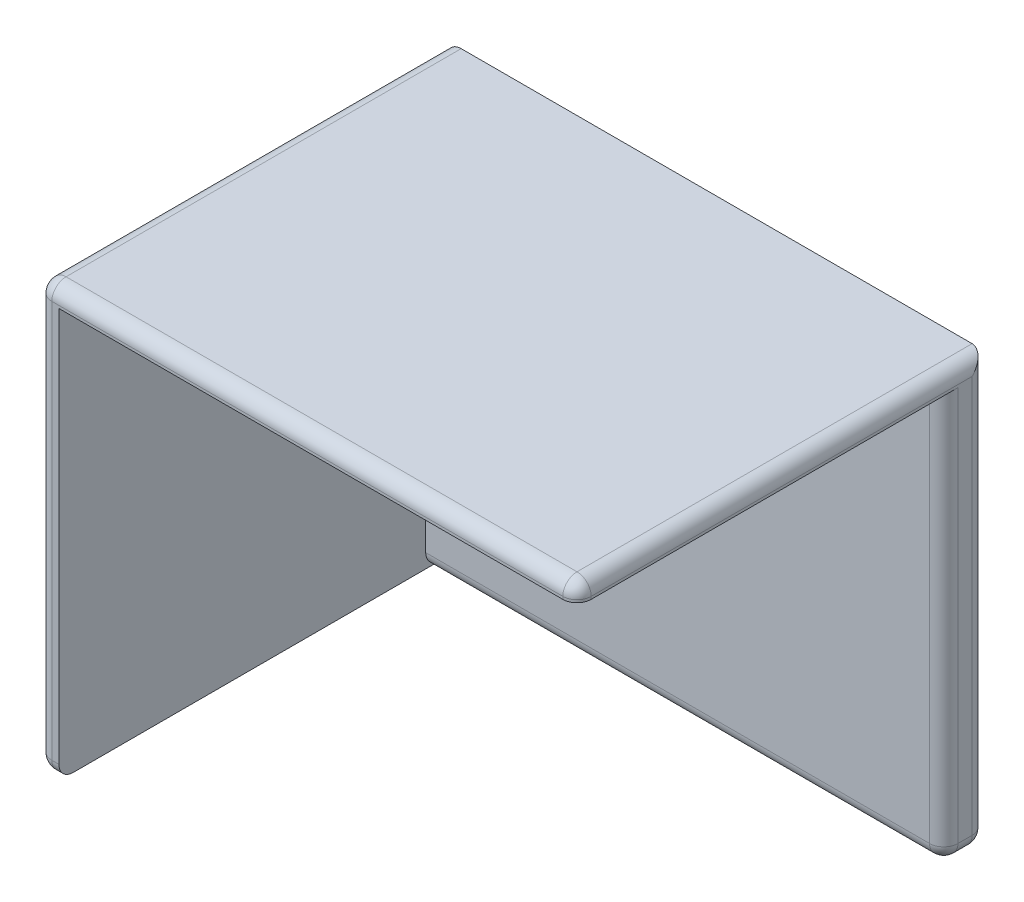
from build123d import *

# Parameters (mm, degrees)
SKETCH1_W           = 38
SKETCH1_H           = 30
SKETCH1_W_2         = 35
SKETCH1_H_2         = 27.631578948
BOSS_EXTRUDE1_DEPTH = 28.84
FILLET1_R           = 1
SKETCH2_W           = 35
SKETCH2_H           = 27.631578948
BOSS_EXTRUDE2_DEPTH = 3
SKETCH3_W           = 36.5
SKETCH3_H           = 28.815789474
CUT_EXTRUDE1_DEPTH  = 36.407705376
FILLET2_R           = 1


with BuildPart() as part:
    # Sketch1 → Boss-Extrude1 (new body)
    with BuildSketch(Plane.XY):
        Rectangle(SKETCH1_W, SKETCH1_H)
        Rectangle(SKETCH1_W_2, SKETCH1_H_2, mode=Mode.SUBTRACT)
    extrude(amount=BOSS_EXTRUDE1_DEPTH)

    # Fillet1
    fillet1_edges = [part.edges().sort_by_distance(p)[0] for p in [
        (19, 0, 28.84),
        (0, 15, 28.84),
        (-19, 0, 28.84),
        (0, -15, 28.84),
    ]]
    fillet(fillet1_edges, radius=FILLET1_R)

    # Sketch2 → Boss-Extrude2 (add)
    with BuildSketch(Plane(origin=(0, 0, 0), x_dir=(-1, 0, 0), z_dir=(0, 0, -1))):
        Rectangle(SKETCH2_W, SKETCH2_H)
    extrude(amount=-BOSS_EXTRUDE2_DEPTH)

    # Sketch3 → Cut-Extrude1 (cut, through all)
    with BuildSketch(Plane(origin=(0, 0, 3), x_dir=(-1, 0, 0), z_dir=(0, 0, -1))):
        with Locations((-0.75, -0.592105263)):
            Rectangle(SKETCH3_W, SKETCH3_H)
    extrude(amount=-CUT_EXTRUDE1_DEPTH, mode=Mode.SUBTRACT)

    # Fillet2
    # the kernel refuses this fillet: 1 mm, written as the material it takes off along each edge
    with BuildSketch(Plane(origin=(-18, -14, 27.84), x_dir=(-1, 0, 0), z_dir=(0, -1, 0))) as fillet2_piece_1_section:
        Polygon((0, 0), (FILLET2_R * 1.02, 0), (FILLET2_R * 1.02, -FILLET2_R * 1.02), (0, -FILLET2_R * 1.02), align=None)
    fillet2_piece_1 = extrude(amount=FILLET2_R * 1.02, mode=Mode.PRIVATE)
    fillet2_piece_1 = fillet2_piece_1 - Plane(origin=(-18, -14, 27.84), x_dir=(0.7071067811865475, 0, -0.7071067811865475), z_dir=(0, -1, 0)) * Sphere(FILLET2_R, mode=Mode.PRIVATE)
    add(fillet2_piece_1, mode=Mode.SUBTRACT)
    with BuildSketch(Plane(origin=(-18, 14, 27.84), x_dir=(-1, 0, 0), z_dir=(0, 1, 0))) as fillet2_piece_2_section:
        Polygon((0, 0), (FILLET2_R * 1.02, 0), (FILLET2_R * 1.02, FILLET2_R * 1.02), (0, FILLET2_R * 1.02), align=None)
    fillet2_piece_2 = extrude(amount=FILLET2_R * 1.02, mode=Mode.PRIVATE)
    fillet2_piece_2 = fillet2_piece_2 - Plane(origin=(-18, 14, 27.84), x_dir=(0.7071067811865475, 0, -0.7071067811865475), z_dir=(0, 1, 0)) * Sphere(FILLET2_R, mode=Mode.PRIVATE)
    add(fillet2_piece_2, mode=Mode.SUBTRACT)
    with BuildSketch(Plane(origin=(18, 14, 27.84), x_dir=(0, 1, 0), z_dir=(1, 0, 0))) as fillet2_piece_3_section:
        Polygon((0, 0), (FILLET2_R * 1.02, 0), (FILLET2_R * 1.02, FILLET2_R * 1.02), (0, FILLET2_R * 1.02), align=None)
    fillet2_piece_3 = extrude(amount=FILLET2_R * 1.02, mode=Mode.PRIVATE)
    fillet2_piece_3 = fillet2_piece_3 - Plane(origin=(18, 14, 27.84), x_dir=(0, -0.7071067811865475, -0.7071067811865475), z_dir=(1, 0, 0)) * Sphere(FILLET2_R, mode=Mode.PRIVATE)
    add(fillet2_piece_3, mode=Mode.SUBTRACT)
    with BuildSketch(Plane(origin=(18, -14, 1), x_dir=(1, 0, 0), z_dir=(0, -1, 0))) as fillet2_piece_4_section:
        Polygon((0, 0), (FILLET2_R * 1.02, 0), (FILLET2_R * 1.02, -FILLET2_R * 1.02), (0, -FILLET2_R * 1.02), align=None)
    fillet2_piece_4 = extrude(amount=FILLET2_R * 1.02, mode=Mode.PRIVATE)
    fillet2_piece_4 = fillet2_piece_4 - Plane(origin=(18, -14, 1), x_dir=(-0.7071067811865475, 0, 0.7071067811865475), z_dir=(0, -1, 0)) * Sphere(FILLET2_R, mode=Mode.PRIVATE)
    add(fillet2_piece_4, mode=Mode.SUBTRACT)
    with BuildSketch(Plane(origin=(18, -14, 2), x_dir=(1, 0, 0), z_dir=(0, -1, 0))) as fillet2_piece_5_section:
        Polygon((0, 0), (FILLET2_R * 1.02, 0), (FILLET2_R * 1.02, FILLET2_R * 1.02), (0, FILLET2_R * 1.02), align=None)
    fillet2_piece_5 = extrude(amount=FILLET2_R * 1.02, mode=Mode.PRIVATE)
    fillet2_piece_5 = fillet2_piece_5 - Plane(origin=(18, -14, 2), x_dir=(-0.7071067811865475, 0, -0.7071067811865475), z_dir=(0, -1, 0)) * Sphere(FILLET2_R, mode=Mode.PRIVATE)
    add(fillet2_piece_5, mode=Mode.SUBTRACT)
    with BuildSketch(Plane(origin=(19, 15, -2.5), x_dir=(0, -1, 0), z_dir=(0, 0, 1)), Plane(origin=(-19, 15, -2.5), x_dir=(1, 0, 0), z_dir=(0, 0, 1))) as fillet2_piece_6:
        with BuildLine():
            CenterArc((FILLET2_R, -FILLET2_R), FILLET2_R, 90, 90)
            Line((0, -FILLET2_R), (0, 0))
            Line((0, 0), (FILLET2_R, 0))
        make_face()
    extrude(amount=30.34, mode=Mode.SUBTRACT)
    with BuildSketch(Plane(origin=(-19, -15, -2.5), x_dir=(1, 0, 0), z_dir=(0, 0, 1))) as fillet2_piece_7:
        with BuildLine():
            CenterArc((FILLET2_R, FILLET2_R), FILLET2_R, 180, 90)
            Line((0, FILLET2_R), (0, 0))
            Line((0, 0), (FILLET2_R, 0))
        make_face()
    extrude(amount=30.34, mode=Mode.SUBTRACT)
    with BuildSketch(Plane(origin=(19, 17.5, 0), x_dir=(0, 0, 1), z_dir=(0, -1, 0))) as fillet2_piece_8:
        with BuildLine():
            CenterArc((FILLET2_R, FILLET2_R), FILLET2_R, 180, 90)
            Line((0, FILLET2_R), (0, 0))
            Line((0, 0), (FILLET2_R, 0))
        make_face()
    extrude(amount=31.5, mode=Mode.SUBTRACT)
    with BuildSketch(Plane(origin=(18, -15, 0), x_dir=(0, 0, 1), z_dir=(-1, 0, 0))) as fillet2_piece_9:
        with BuildLine():
            CenterArc((FILLET2_R, FILLET2_R), FILLET2_R, 180, 90)
            Line((0, FILLET2_R), (0, 0))
            Line((0, 0), (FILLET2_R, 0))
        make_face()
    extrude(amount=39.5, mode=Mode.SUBTRACT)
    with BuildSketch(Plane(origin=(19, -15, 1), x_dir=(-1, 0, 0), z_dir=(0, 0, 1))) as fillet2_piece_10:
        with BuildLine():
            CenterArc((FILLET2_R, -FILLET2_R), FILLET2_R, 90, 90)
            Line((0, -FILLET2_R), (0, 0))
            Line((0, 0), (FILLET2_R, 0))
        make_face()
    extrude(amount=1, mode=Mode.SUBTRACT)
    with BuildSketch(Plane(origin=(19, 13.815789474, 3), x_dir=(0, 0, -1), z_dir=(0, -1, 0))) as fillet2_piece_11:
        with BuildLine():
            CenterArc((FILLET2_R, -FILLET2_R), FILLET2_R, 90, 90)
            Line((0, -FILLET2_R), (0, 0))
            Line((0, 0), (FILLET2_R, 0))
        make_face()
    extrude(amount=27.815789474, mode=Mode.SUBTRACT)
    with BuildSketch(Plane(origin=(18, -15, 3), x_dir=(0, 0, -1), z_dir=(-1, 0, 0))) as fillet2_piece_12:
        with BuildLine():
            CenterArc((FILLET2_R, -FILLET2_R), FILLET2_R, 90, 90)
            Line((0, -FILLET2_R), (0, 0))
            Line((0, 0), (FILLET2_R, 0))
        make_face()
    extrude(amount=35.5, mode=Mode.SUBTRACT)


solid = part.part
